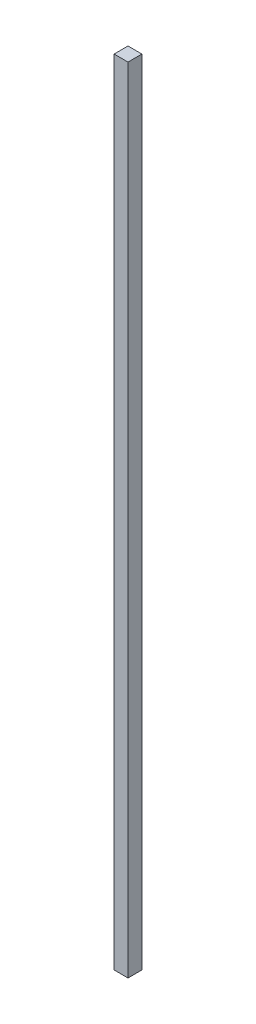
from build123d import *

# Parameters (mm, degrees)
SKETCH1_W           = 25.4
SKETCH1_H           = 25.4
BOSS_EXTRUDE1_DEPTH = 1447.8


with BuildPart() as part:
    # Sketch1 → Boss-Extrude1 (new body)
    with BuildSketch(Plane(origin=(0, 0, 0), x_dir=(1, 0, 0), z_dir=(0, 1, 0))):
        with Locations((12.7, 12.7)):
            Rectangle(SKETCH1_W, SKETCH1_H)
    extrude(amount=BOSS_EXTRUDE1_DEPTH)


solid = part.part
